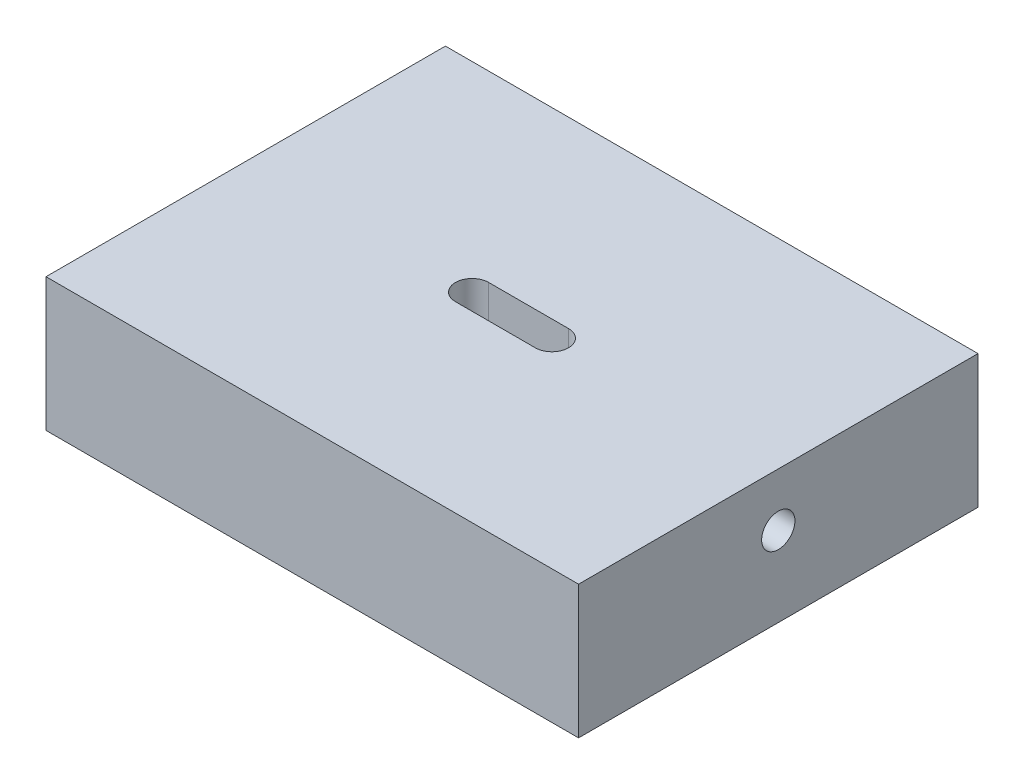
from build123d import *

# Parameters (mm, degrees)
SKETCH1_W           = 50.8
SKETCH1_H           = 38.1
BOSS_EXTRUDE1_DEPTH = 12.7
SKETCH2_R           = 1.5875
CUT_EXTRUDE1_DEPTH  = 31.75
CUT_EXTRUDE2_DEPTH  = 5.08
SKETCH4_R           = 1.5875
CUT_EXTRUDE3_DEPTH  = 7.62
CHAMFER1_SIZE       = 0.635
THREAD1_PITCH       = 0.79375
THREAD2_PITCH       = 0.79375


with BuildPart() as part:
    # Sketch1 → Boss-Extrude1 (new body)
    with BuildSketch(Plane(origin=(0, 0, 0), x_dir=(1, 0, 0), z_dir=(0, 1, 0))):
        Rectangle(SKETCH1_W, SKETCH1_H)
    extrude(amount=BOSS_EXTRUDE1_DEPTH)

    # Sketch2 → Cut-Extrude1 (cut)
    with BuildSketch(Plane(origin=(25.4, 0, 0), x_dir=(0, 0, -1), z_dir=(1, 0, 0))):
        with Locations((0, 7.62)):
            Circle(SKETCH2_R)
    extrude(amount=-CUT_EXTRUDE1_DEPTH, mode=Mode.SUBTRACT)

    # Sketch3 → Cut-Extrude2 (cut)
    with BuildSketch(Plane(origin=(0, 12.7, 0), x_dir=(1, 0, 0), z_dir=(0, 1, 0))):
        with BuildLine():
            Line((-3.81, 1.5875), (3.81, 1.5875))
            ThreePointArc((3.81, 1.5875), (5.3975, 0), (3.81, -1.5875))
            Line((3.81, -1.5875), (-3.81, -1.5875))
            ThreePointArc((-3.81, -1.5875), (-5.3975, 0), (-3.81, 1.5875))
        make_face()
    extrude(amount=-CUT_EXTRUDE2_DEPTH, mode=Mode.SUBTRACT)

    # Sketch4 → Cut-Extrude3 (cut)
    with BuildSketch(Plane.XZ):
        with Locations(Location((0, 0, 0), (0, 0, 270))):
            Circle(SKETCH4_R)
        with Locations(Location((19.05, 0, 0), (0, 0, 270))):
            Circle(SKETCH4_R)
    extrude(amount=-CUT_EXTRUDE3_DEPTH, mode=Mode.SUBTRACT)

    # Chamfer1
    chamfer1_edges = [part.edges().sort_by_distance(p)[0] for p in [
        (0, 0, 1.5875),
        (19.05, 0, 1.5875),
    ]]
    chamfer(chamfer1_edges, length=CHAMFER1_SIZE)

    # Thread1: the profile of Thread Profile1 profile screwed along a right-hand helix of 9.6 turns, 8 arcs to a turn; built about Z, then put on its axis
    thread1_z = Axis((0, 0, 0), (0, 0, 1))
    thread1_corners = [(1.5872, 0, -0.000173205), (2.017129788, 0, 0.248046874), (2.017129788, 0, 0.347265624), (1.5872, 0, 0.595485703)]
    with BuildLine(mode=Mode.PRIVATE) as thread1_profile:
        Line(thread1_corners[0], thread1_corners[1])
        Line(thread1_corners[1], thread1_corners[2])
        Line(thread1_corners[2], thread1_corners[3])
        Line(thread1_corners[3], thread1_corners[0])
    thread1_cap = Face(thread1_profile.wire())
    thread1_turn_angles = [0, 22.5, 45, 67.5, 90, 112.5, 135, 157.5, 180, 202.5, 225, 247.5, 270, 292.5, 315, 337.5, 360]
    thread1_turn_weights = [1, 0.9238795325112867, 1, 0.9238795325112867, 1, 0.9238795325112867, 1, 0.9238795325112867, 1, 0.9238795325112867, 1, 0.9238795325112867, 1, 0.9238795325112867, 1, 0.9238795325112867, 1]
    thread1_turn_rails = [Edge.make_bspline([Vector(p[0], p[1], 0).rotate(thread1_z, thread1_turn_angles[k]) / thread1_turn_weights[k] + Vector(0, 0, p[2] + THREAD1_PITCH * thread1_turn_angles[k] / 360) for k in range(17)], [0, 0, 0, 1, 1, 2, 2, 3, 3, 4, 4, 5, 5, 6, 6, 7, 7, 8, 8, 8], 2, thread1_turn_weights) for p in thread1_corners]
    thread1_turn_sides = [Face.make_surface_from_curves(thread1_turn_rails[p[0]], thread1_turn_rails[p[1]]) for p in [(0, 1), (1, 2), (2, 3), (3, 0)]]
    thread1_last_angles = [3240, 3262.5, 3285, 3307.5, 3330, 3352.5, 3375, 3397.5, 3420, 3438, 3456]
    thread1_last_weights = [1, 0.9238795325112867, 1, 0.9238795325112867, 1, 0.9238795325112867, 1, 0.9238795325112867, 1, 0.9510565162951535, 1]
    thread1_last_rails = [Edge.make_bspline([Vector(p[0], p[1], 0).rotate(thread1_z, thread1_last_angles[k]) / thread1_last_weights[k] + Vector(0, 0, p[2] + THREAD1_PITCH * thread1_last_angles[k] / 360) for k in range(11)], [0, 0, 0, 1, 1, 2, 2, 3, 3, 4, 4, 5, 5, 5], 2, thread1_last_weights) for p in thread1_corners]
    thread1_last_sides = [Face.make_surface_from_curves(thread1_last_rails[p[0]], thread1_last_rails[p[1]]) for p in [(0, 1), (1, 2), (2, 3), (3, 0)]]
    thread1 = Plane(origin=(0, -0.381, 0), x_dir=(1, 0, 0), z_dir=(0, 1, 0)) * Solid(Shell([*[p.moved(Location((0, 0, THREAD1_PITCH * i))) for i in range(9) for p in thread1_turn_sides], *thread1_last_sides, thread1_cap, thread1_cap.rotate(thread1_z, 3456).moved(Location((0, 0, THREAD1_PITCH * 3456 / 360)))]))
    add(thread1, mode=Mode.SUBTRACT)

    # Thread2: the profile of Thread Profile2 profile screwed along a right-hand helix of 9.6 turns, 8 arcs to a turn; built about Z, then put on its axis
    thread2_z = Axis((0, 0, 0), (0, 0, 1))
    thread2_corners = [(1.5872, 0, -0.000173205), (2.017129788, 0, 0.248046874), (2.017129788, 0, 0.347265624), (1.5872, 0, 0.595485703)]
    with BuildLine(mode=Mode.PRIVATE) as thread2_profile:
        Line(thread2_corners[0], thread2_corners[1])
        Line(thread2_corners[1], thread2_corners[2])
        Line(thread2_corners[2], thread2_corners[3])
        Line(thread2_corners[3], thread2_corners[0])
    thread2_cap = Face(thread2_profile.wire())
    thread2_turn_angles = [0, 22.5, 45, 67.5, 90, 112.5, 135, 157.5, 180, 202.5, 225, 247.5, 270, 292.5, 315, 337.5, 360]
    thread2_turn_weights = [1, 0.9238795325112867, 1, 0.9238795325112867, 1, 0.9238795325112867, 1, 0.9238795325112867, 1, 0.9238795325112867, 1, 0.9238795325112867, 1, 0.9238795325112867, 1, 0.9238795325112867, 1]
    thread2_turn_rails = [Edge.make_bspline([Vector(p[0], p[1], 0).rotate(thread2_z, thread2_turn_angles[k]) / thread2_turn_weights[k] + Vector(0, 0, p[2] + THREAD2_PITCH * thread2_turn_angles[k] / 360) for k in range(17)], [0, 0, 0, 1, 1, 2, 2, 3, 3, 4, 4, 5, 5, 6, 6, 7, 7, 8, 8, 8], 2, thread2_turn_weights) for p in thread2_corners]
    thread2_turn_sides = [Face.make_surface_from_curves(thread2_turn_rails[p[0]], thread2_turn_rails[p[1]]) for p in [(0, 1), (1, 2), (2, 3), (3, 0)]]
    thread2_last_angles = [3240, 3262.5, 3285, 3307.5, 3330, 3352.5, 3375, 3397.5, 3420, 3438, 3456]
    thread2_last_weights = [1, 0.9238795325112867, 1, 0.9238795325112867, 1, 0.9238795325112867, 1, 0.9238795325112867, 1, 0.9510565162951535, 1]
    thread2_last_rails = [Edge.make_bspline([Vector(p[0], p[1], 0).rotate(thread2_z, thread2_last_angles[k]) / thread2_last_weights[k] + Vector(0, 0, p[2] + THREAD2_PITCH * thread2_last_angles[k] / 360) for k in range(11)], [0, 0, 0, 1, 1, 2, 2, 3, 3, 4, 4, 5, 5, 5], 2, thread2_last_weights) for p in thread2_corners]
    thread2_last_sides = [Face.make_surface_from_curves(thread2_last_rails[p[0]], thread2_last_rails[p[1]]) for p in [(0, 1), (1, 2), (2, 3), (3, 0)]]
    thread2 = Plane(origin=(19.05, -0.381, 0), x_dir=(1, 0, 0), z_dir=(0, 1, 0)) * Solid(Shell([*[p.moved(Location((0, 0, THREAD2_PITCH * i))) for i in range(9) for p in thread2_turn_sides], *thread2_last_sides, thread2_cap, thread2_cap.rotate(thread2_z, 3456).moved(Location((0, 0, THREAD2_PITCH * 3456 / 360)))]))
    add(thread2, mode=Mode.SUBTRACT)


solid = part.part
